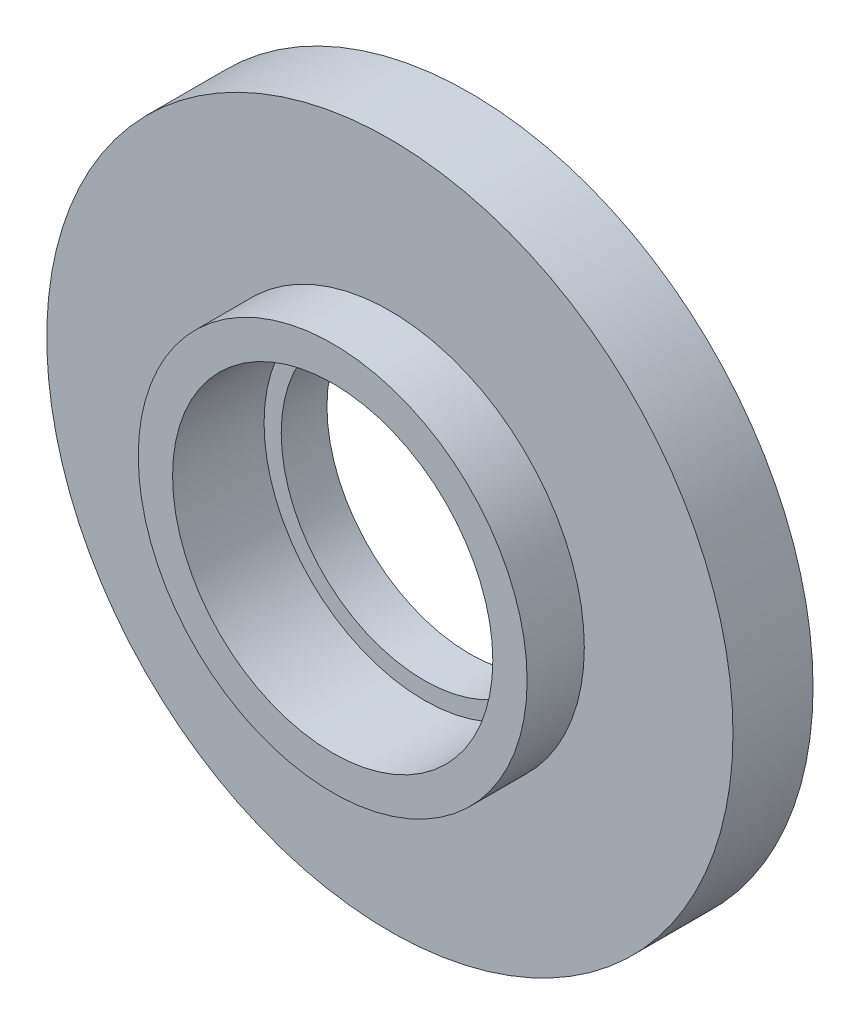
from build123d import *

# Parameters (mm, degrees)
SKETCH4_R          = 14
CUT_EXTRUDE1_DEPTH = 8
SKETCH5_R          = 12.5
CUT_EXTRUDE4_DEPTH = 8.1
SKETCH7_R          = 2.5
CUT_EXTRUDE5_DEPTH = 3


with BuildPart() as part:
    # Sketch2 → Revolve4 (revolve)
    with BuildSketch(Plane(origin=(0, 0, 0), x_dir=(1, 0, 0), z_dir=(0, 1, 0))):
        Polygon((0, 0), (-30, 0), (-30, -7), (-17, -7), (-17, -12), (0, -12), align=None)
    revolve(axis=Axis((0, 0, 12), (0, 0, -1)))

    # Sketch4 → Cut-Extrude1 (cut)
    with BuildSketch(Plane.XY.offset(12)):
        Circle(SKETCH4_R)
    extrude(amount=-CUT_EXTRUDE1_DEPTH, mode=Mode.SUBTRACT)

    # Sketch5 → Cut-Extrude4 (cut)
    with BuildSketch(Plane(origin=(0, 0, 0), x_dir=(-1, 0, 0), z_dir=(0, 0, -1))):
        Circle(SKETCH5_R)
    extrude(amount=-CUT_EXTRUDE4_DEPTH, mode=Mode.SUBTRACT)

    # Sketch7 → Cut-Extrude5 (cut)
    with BuildSketch(Plane(origin=(0, 0, 0), x_dir=(-1, 0, 0), z_dir=(0, 0, -1))):
        with Locations((0, 20)):
            Circle(SKETCH7_R)
        with Locations((17.320508076, 10)):
            Circle(SKETCH7_R)
        with Locations((17.320508076, -10)):
            Circle(SKETCH7_R)
        with Locations((0, -20)):
            Circle(SKETCH7_R)
        with Locations((-17.320508076, -10)):
            Circle(SKETCH7_R)
        with Locations((-17.320508076, 10)):
            Circle(SKETCH7_R)
    extrude(amount=-CUT_EXTRUDE5_DEPTH, mode=Mode.SUBTRACT)


solid = part.part
